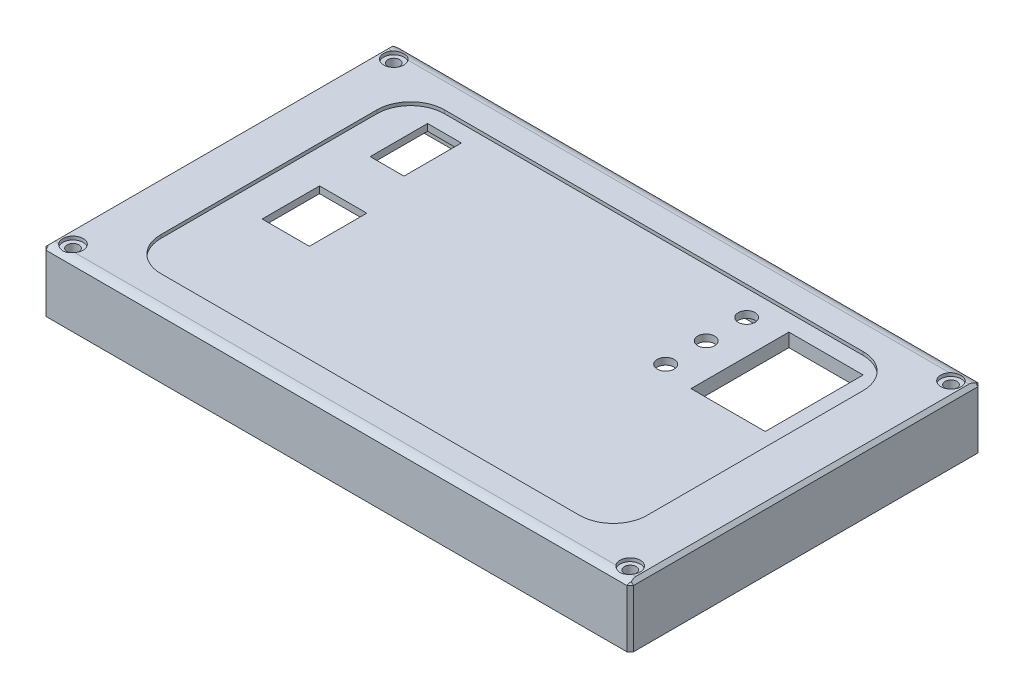
from build123d import *

# Parameters (mm, degrees)
SKETCH1_W           = 174
SKETCH1_H           = 104
BOSS_EXTRUDE3_DEPTH = 18
SKETCH5_W           = 172
SKETCH5_H           = 102
CUT_EXTRUDE2_DEPTH  = 10
SKETCH6_W           = 170
SKETCH6_H           = 100
CUT_EXTRUDE4_DEPTH  = 5
BOSS_EXTRUDE4_DEPTH = 5
SKETCH10_R          = 1.75
CUT_EXTRUDE5_DEPTH  = 8
SKETCH11_R          = 3
CUT_EXTRUDE6_DEPTH  = 1
SKETCH12_W          = 144
SKETCH12_H          = 84
CUT_EXTRUDE7_DEPTH  = 1
FILLET1_R           = 10
CHAMFER1_SIZE       = 1
SKETCH13_W          = 22
SKETCH13_H          = 29
CUT_EXTRUDE8_DEPTH  = 2
SKETCH14_R          = 2.5
CUT_EXTRUDE9_DEPTH  = 2
SKETCH15_R          = 3
BOSS_EXTRUDE5_DEPTH = 5
SKETCH16_R          = 1.75
CUT_EXTRUDE10_DEPTH = 3
THREAD1_PITCH       = 1.27
THREAD2_PITCH       = 1.27
THREAD3_PITCH       = 1.27
THREAD4_PITCH       = 1.27
SKETCH25_W          = 14
SKETCH25_H          = 17
SKETCH25_W_2        = 10
CUT_EXTRUDE11_DEPTH = 2
SKETCH26_W          = 25
SKETCH26_H          = 32
SKETCH26_W_2        = 22
SKETCH26_H_2        = 29
BOSS_EXTRUDE6_DEPTH = 2
FILLET3_R           = 4


with BuildPart() as part:
    # Sketch1 → Boss-Extrude3 (new body)
    with BuildSketch(Plane(origin=(0, 0, 0), x_dir=(1, 0, 0), z_dir=(0, 1, 0))):
        with Locations((87, 52)):
            Rectangle(SKETCH1_W, SKETCH1_H)
    extrude(amount=-BOSS_EXTRUDE3_DEPTH)

    # Sketch5 → Cut-Extrude2 (cut)
    with BuildSketch(Plane(origin=(0, -18, 0), x_dir=(-1, 0, 0), z_dir=(0, -1, 0))):
        with Locations((-87, 52)):
            Rectangle(SKETCH5_W, SKETCH5_H)
    extrude(amount=-CUT_EXTRUDE2_DEPTH, mode=Mode.SUBTRACT)

    # Sketch6 → Cut-Extrude4 (cut)
    with BuildSketch(Plane.XZ.offset(8)):
        with Locations((87, -52)):
            Rectangle(SKETCH6_W, SKETCH6_H)
    extrude(amount=-CUT_EXTRUDE4_DEPTH, mode=Mode.SUBTRACT)

    # Sketch7 → Boss-Extrude4 (add)
    with BuildSketch(Plane(origin=(0, -3, 0), x_dir=(-1, 0, 0), z_dir=(0, -1, 0))):
        with BuildLine():
            Line((-165.169872981, 102), (-172, 102))
            Line((-172, 102), (-172, 95.169872981))
            ThreePointArc((-172, 95.169872981), (-165.964466094, 95.964466094), (-165.169872981, 102))
        make_face()
        with BuildLine():
            Line((-2, 95.169872981), (-2, 102))
            Line((-2, 102), (-8.830127019, 102))
            ThreePointArc((-8.830127019, 102), (-8.035533906, 95.964466094), (-2, 95.169872981))
        make_face()
        with BuildLine():
            Line((-8.830127019, 2), (-2, 2))
            Line((-2, 2), (-2, 8.830127019))
            ThreePointArc((-2, 8.830127019), (-8.035533906, 8.035533906), (-8.830127019, 2))
        make_face()
        with BuildLine():
            Line((-172, 8.830127019), (-172, 2))
            Line((-172, 2), (-165.169872981, 2))
            ThreePointArc((-165.169872981, 2), (-165.964466094, 8.035533906), (-172, 8.830127019))
        make_face()
    extrude(amount=BOSS_EXTRUDE4_DEPTH)

    # Sketch10 → Cut-Extrude5 (cut)
    with BuildSketch(Plane(origin=(0, -8, 0), x_dir=(-1, 0, 0), z_dir=(0, -1, 0))):
        with Locations(Location((-169.5, 4.5, 0), (0, 0, 90))):
            Circle(SKETCH10_R)
        with Locations(Location((-4.5, 4.5, 0), (0, 0, 90))):
            Circle(SKETCH10_R)
        with Locations(Location((-4.5, 99.5, 0), (0, 0, 90))):
            Circle(SKETCH10_R)
        with Locations(Location((-169.5, 99.5, 0), (0, 0, 90))):
            Circle(SKETCH10_R)
    extrude(amount=-CUT_EXTRUDE5_DEPTH, mode=Mode.SUBTRACT)

    # Sketch11 → Cut-Extrude6 (cut)
    with BuildSketch(Plane(origin=(0, 0, 0), x_dir=(1, 0, 0), z_dir=(0, 1, 0))):
        with Locations(Location((4.5, 99.5, 0), (0, 0, 270))):
            Circle(SKETCH11_R)
        with Locations(Location((169.5, 99.5, 0), (0, 0, 270))):
            Circle(SKETCH11_R)
        with Locations(Location((169.5, 4.5, 0), (0, 0, 270))):
            Circle(SKETCH11_R)
        with Locations(Location((4.5, 4.5, 0), (0, 0, 270))):
            Circle(SKETCH11_R)
    extrude(amount=-CUT_EXTRUDE6_DEPTH, mode=Mode.SUBTRACT)

    # Sketch12 → Cut-Extrude7 (cut)
    with BuildSketch(Plane(origin=(0, 0, 0), x_dir=(1, 0, 0), z_dir=(0, 1, 0))):
        with Locations((87, 52)):
            Rectangle(SKETCH12_W, SKETCH12_H)
    extrude(amount=-CUT_EXTRUDE7_DEPTH, mode=Mode.SUBTRACT)

    # Fillet1
    fillet1_edges = [part.edges().sort_by_distance(p)[0] for p in [
        (15, -0.5, -10),
        (15, -0.5, -94),
        (159, -0.5, -94),
        (159, -0.5, -10),
    ]]
    fillet(fillet1_edges, radius=FILLET1_R)

    # Chamfer1
    chamfer1_edges = [part.edges().sort_by_distance(p)[0] for p in [
        (87, 0, -104),
        (174, 0, -52),
        (87, 0, 0),
        (0, 0, -52),
        (0, -9, -104),
        (174, -9, -104),
        (174, -9, 0),
        (0, -9, 0),
    ]]
    chamfer(chamfer1_edges, length=CHAMFER1_SIZE)

    # Sketch13 → Cut-Extrude8 (cut)
    with BuildSketch(Plane(origin=(0, -1, 0), x_dir=(1, 0, 0), z_dir=(0, 1, 0))):
        with Locations((143, 74.5)):
            Rectangle(SKETCH13_W, SKETCH13_H)
    extrude(amount=-CUT_EXTRUDE8_DEPTH, mode=Mode.SUBTRACT)

    # Sketch14 → Cut-Extrude9 (cut)
    with BuildSketch(Plane(origin=(0, -1, 0), x_dir=(1, 0, 0), z_dir=(0, 1, 0))):
        with Locations(Location((122, 86.5, 0), (0, 0, 270))):
            Circle(SKETCH14_R)
        with Locations(Location((122, 74.5, 0), (0, 0, 270))):
            Circle(SKETCH14_R)
        with Locations(Location((122, 62.5, 0), (0, 0, 270))):
            Circle(SKETCH14_R)
    extrude(amount=-CUT_EXTRUDE9_DEPTH, mode=Mode.SUBTRACT)

    # Sketch15 → Boss-Extrude5 (add)
    with BuildSketch(Plane(origin=(0, -1, 0), x_dir=(1, 0, 0), z_dir=(0, 1, 0))):
        with Locations(Location((162, 92, 0), (0, 0, 270))):
            Circle(SKETCH15_R)
        with Locations(Location((98, 92, 0), (0, 0, 270))):
            Circle(SKETCH15_R)
        with Locations(Location((162, 48, 0), (0, 0, 270))):
            Circle(SKETCH15_R)
        with Locations(Location((98, 48, 0), (0, 0, 270))):
            Circle(SKETCH15_R)
    extrude(amount=-BOSS_EXTRUDE5_DEPTH)

    # Sketch16 → Cut-Extrude10 (cut)
    with BuildSketch(Plane(origin=(0, -6, 0), x_dir=(-1, 0, 0), z_dir=(0, -1, 0))):
        with Locations(Location((-162, 92, 0), (0, 0, 90))):
            Circle(SKETCH16_R)
        with Locations(Location((-98, 92, 0), (0, 0, 90))):
            Circle(SKETCH16_R)
        with Locations(Location((-162, 48, 0), (0, 0, 90))):
            Circle(SKETCH16_R)
        with Locations(Location((-98, 48, 0), (0, 0, 90))):
            Circle(SKETCH16_R)
    extrude(amount=-CUT_EXTRUDE10_DEPTH, mode=Mode.SUBTRACT)

    # Thread1: the profile of Thread Profile1 profile screwed along a right-hand helix of 2.362205 turns, 8 arcs to a turn; built about Z, then put on its axis
    thread1_z = Axis((0, 0, 0), (0, 0, 1))
    thread1_corners = [(1.7503, 0, -0.000173205), (1.7503, 0, 1.111423202), (1.062592339, 0, 0.714374998), (1.062592339, 0, 0.396874998)]
    with BuildLine(mode=Mode.PRIVATE) as thread1_profile:
        Line(thread1_corners[0], thread1_corners[1])
        Line(thread1_corners[1], thread1_corners[2])
        Line(thread1_corners[2], thread1_corners[3])
        Line(thread1_corners[3], thread1_corners[0])
    thread1_cap = Face(thread1_profile.wire())
    thread1_turn_angles = [0, 22.5, 45, 67.5, 90, 112.5, 135, 157.5, 180, 202.5, 225, 247.5, 270, 292.5, 315, 337.5, 360]
    thread1_turn_weights = [1, 0.9238795325112867, 1, 0.9238795325112867, 1, 0.9238795325112867, 1, 0.9238795325112867, 1, 0.9238795325112867, 1, 0.9238795325112867, 1, 0.9238795325112867, 1, 0.9238795325112867, 1]
    thread1_turn_rails = [Edge.make_bspline([Vector(p[0], p[1], 0).rotate(thread1_z, thread1_turn_angles[k]) / thread1_turn_weights[k] + Vector(0, 0, p[2] + THREAD1_PITCH * thread1_turn_angles[k] / 360) for k in range(17)], [0, 0, 0, 1, 1, 2, 2, 3, 3, 4, 4, 5, 5, 6, 6, 7, 7, 8, 8, 8], 2, thread1_turn_weights) for p in thread1_corners]
    thread1_turn_sides = [Face.make_surface_from_curves(thread1_turn_rails[p[0]], thread1_turn_rails[p[1]]) for p in [(0, 1), (1, 2), (2, 3), (3, 0)]]
    thread1_last_angles = [720, 742.5, 765, 787.5, 810, 830.196850394, 850.393700787]
    thread1_last_weights = [1, 0.9238795325112867, 1, 0.9238795325112867, 1, 0.9385120027288909, 1]
    thread1_last_rails = [Edge.make_bspline([Vector(p[0], p[1], 0).rotate(thread1_z, thread1_last_angles[k]) / thread1_last_weights[k] + Vector(0, 0, p[2] + THREAD1_PITCH * thread1_last_angles[k] / 360) for k in range(7)], [0, 0, 0, 1, 1, 2, 2, 3, 3, 3], 2, thread1_last_weights) for p in thread1_corners]
    thread1_last_sides = [Face.make_surface_from_curves(thread1_last_rails[p[0]], thread1_last_rails[p[1]]) for p in [(0, 1), (1, 2), (2, 3), (3, 0)]]
    thread1 = Plane(origin=(162, -6, -92), x_dir=(1, 0, 0), z_dir=(0, 1, 0)) * Solid(Shell([*[p.moved(Location((0, 0, THREAD1_PITCH * i))) for i in range(2) for p in thread1_turn_sides], *thread1_last_sides, thread1_cap, thread1_cap.rotate(thread1_z, 850.393700787).moved(Location((0, 0, THREAD1_PITCH * 850.393700787 / 360)))]))
    add(thread1)

    # Thread2: the profile of Thread Profile2 profile screwed along a right-hand helix of 2.362205 turns, 8 arcs to a turn; built about Z, then put on its axis
    thread2_z = Axis((0, 0, 0), (0, 0, 1))
    thread2_corners = [(1.7503, 0, -0.000173205), (1.7503, 0, 1.111423202), (1.062592339, 0, 0.714374998), (1.062592339, 0, 0.396874998)]
    with BuildLine(mode=Mode.PRIVATE) as thread2_profile:
        Line(thread2_corners[0], thread2_corners[1])
        Line(thread2_corners[1], thread2_corners[2])
        Line(thread2_corners[2], thread2_corners[3])
        Line(thread2_corners[3], thread2_corners[0])
    thread2_cap = Face(thread2_profile.wire())
    thread2_turn_angles = [0, 22.5, 45, 67.5, 90, 112.5, 135, 157.5, 180, 202.5, 225, 247.5, 270, 292.5, 315, 337.5, 360]
    thread2_turn_weights = [1, 0.9238795325112867, 1, 0.9238795325112867, 1, 0.9238795325112867, 1, 0.9238795325112867, 1, 0.9238795325112867, 1, 0.9238795325112867, 1, 0.9238795325112867, 1, 0.9238795325112867, 1]
    thread2_turn_rails = [Edge.make_bspline([Vector(p[0], p[1], 0).rotate(thread2_z, thread2_turn_angles[k]) / thread2_turn_weights[k] + Vector(0, 0, p[2] + THREAD2_PITCH * thread2_turn_angles[k] / 360) for k in range(17)], [0, 0, 0, 1, 1, 2, 2, 3, 3, 4, 4, 5, 5, 6, 6, 7, 7, 8, 8, 8], 2, thread2_turn_weights) for p in thread2_corners]
    thread2_turn_sides = [Face.make_surface_from_curves(thread2_turn_rails[p[0]], thread2_turn_rails[p[1]]) for p in [(0, 1), (1, 2), (2, 3), (3, 0)]]
    thread2_last_angles = [720, 742.5, 765, 787.5, 810, 830.196850394, 850.393700787]
    thread2_last_weights = [1, 0.9238795325112867, 1, 0.9238795325112867, 1, 0.9385120027288909, 1]
    thread2_last_rails = [Edge.make_bspline([Vector(p[0], p[1], 0).rotate(thread2_z, thread2_last_angles[k]) / thread2_last_weights[k] + Vector(0, 0, p[2] + THREAD2_PITCH * thread2_last_angles[k] / 360) for k in range(7)], [0, 0, 0, 1, 1, 2, 2, 3, 3, 3], 2, thread2_last_weights) for p in thread2_corners]
    thread2_last_sides = [Face.make_surface_from_curves(thread2_last_rails[p[0]], thread2_last_rails[p[1]]) for p in [(0, 1), (1, 2), (2, 3), (3, 0)]]
    thread2 = Plane(origin=(98, -6, -92), x_dir=(1, 0, 0), z_dir=(0, 1, 0)) * Solid(Shell([*[p.moved(Location((0, 0, THREAD2_PITCH * i))) for i in range(2) for p in thread2_turn_sides], *thread2_last_sides, thread2_cap, thread2_cap.rotate(thread2_z, 850.393700787).moved(Location((0, 0, THREAD2_PITCH * 850.393700787 / 360)))]))
    add(thread2)

    # Thread3: the profile of Thread Profile3 profile screwed along a right-hand helix of 2.362205 turns, 8 arcs to a turn; built about Z, then put on its axis
    thread3_z = Axis((0, 0, 0), (0, 0, 1))
    thread3_corners = [(1.7503, 0, -0.000173205), (1.7503, 0, 1.111423202), (1.062592339, 0, 0.714374998), (1.062592339, 0, 0.396874998)]
    with BuildLine(mode=Mode.PRIVATE) as thread3_profile:
        Line(thread3_corners[0], thread3_corners[1])
        Line(thread3_corners[1], thread3_corners[2])
        Line(thread3_corners[2], thread3_corners[3])
        Line(thread3_corners[3], thread3_corners[0])
    thread3_cap = Face(thread3_profile.wire())
    thread3_turn_angles = [0, 22.5, 45, 67.5, 90, 112.5, 135, 157.5, 180, 202.5, 225, 247.5, 270, 292.5, 315, 337.5, 360]
    thread3_turn_weights = [1, 0.9238795325112867, 1, 0.9238795325112867, 1, 0.9238795325112867, 1, 0.9238795325112867, 1, 0.9238795325112867, 1, 0.9238795325112867, 1, 0.9238795325112867, 1, 0.9238795325112867, 1]
    thread3_turn_rails = [Edge.make_bspline([Vector(p[0], p[1], 0).rotate(thread3_z, thread3_turn_angles[k]) / thread3_turn_weights[k] + Vector(0, 0, p[2] + THREAD3_PITCH * thread3_turn_angles[k] / 360) for k in range(17)], [0, 0, 0, 1, 1, 2, 2, 3, 3, 4, 4, 5, 5, 6, 6, 7, 7, 8, 8, 8], 2, thread3_turn_weights) for p in thread3_corners]
    thread3_turn_sides = [Face.make_surface_from_curves(thread3_turn_rails[p[0]], thread3_turn_rails[p[1]]) for p in [(0, 1), (1, 2), (2, 3), (3, 0)]]
    thread3_last_angles = [720, 742.5, 765, 787.5, 810, 830.196850394, 850.393700787]
    thread3_last_weights = [1, 0.9238795325112867, 1, 0.9238795325112867, 1, 0.9385120027288909, 1]
    thread3_last_rails = [Edge.make_bspline([Vector(p[0], p[1], 0).rotate(thread3_z, thread3_last_angles[k]) / thread3_last_weights[k] + Vector(0, 0, p[2] + THREAD3_PITCH * thread3_last_angles[k] / 360) for k in range(7)], [0, 0, 0, 1, 1, 2, 2, 3, 3, 3], 2, thread3_last_weights) for p in thread3_corners]
    thread3_last_sides = [Face.make_surface_from_curves(thread3_last_rails[p[0]], thread3_last_rails[p[1]]) for p in [(0, 1), (1, 2), (2, 3), (3, 0)]]
    thread3 = Plane(origin=(98, -6, -48), x_dir=(1, 0, 0), z_dir=(0, 1, 0)) * Solid(Shell([*[p.moved(Location((0, 0, THREAD3_PITCH * i))) for i in range(2) for p in thread3_turn_sides], *thread3_last_sides, thread3_cap, thread3_cap.rotate(thread3_z, 850.393700787).moved(Location((0, 0, THREAD3_PITCH * 850.393700787 / 360)))]))
    add(thread3)

    # Thread4: the profile of Thread Profile4 profile screwed along a right-hand helix of 2.362205 turns, 8 arcs to a turn; built about Z, then put on its axis
    thread4_z = Axis((0, 0, 0), (0, 0, 1))
    thread4_corners = [(1.7503, 0, -0.000173205), (1.7503, 0, 1.111423202), (1.062592339, 0, 0.714374998), (1.062592339, 0, 0.396874998)]
    with BuildLine(mode=Mode.PRIVATE) as thread4_profile:
        Line(thread4_corners[0], thread4_corners[1])
        Line(thread4_corners[1], thread4_corners[2])
        Line(thread4_corners[2], thread4_corners[3])
        Line(thread4_corners[3], thread4_corners[0])
    thread4_cap = Face(thread4_profile.wire())
    thread4_turn_angles = [0, 22.5, 45, 67.5, 90, 112.5, 135, 157.5, 180, 202.5, 225, 247.5, 270, 292.5, 315, 337.5, 360]
    thread4_turn_weights = [1, 0.9238795325112867, 1, 0.9238795325112867, 1, 0.9238795325112867, 1, 0.9238795325112867, 1, 0.9238795325112867, 1, 0.9238795325112867, 1, 0.9238795325112867, 1, 0.9238795325112867, 1]
    thread4_turn_rails = [Edge.make_bspline([Vector(p[0], p[1], 0).rotate(thread4_z, thread4_turn_angles[k]) / thread4_turn_weights[k] + Vector(0, 0, p[2] + THREAD4_PITCH * thread4_turn_angles[k] / 360) for k in range(17)], [0, 0, 0, 1, 1, 2, 2, 3, 3, 4, 4, 5, 5, 6, 6, 7, 7, 8, 8, 8], 2, thread4_turn_weights) for p in thread4_corners]
    thread4_turn_sides = [Face.make_surface_from_curves(thread4_turn_rails[p[0]], thread4_turn_rails[p[1]]) for p in [(0, 1), (1, 2), (2, 3), (3, 0)]]
    thread4_last_angles = [720, 742.5, 765, 787.5, 810, 830.196850394, 850.393700787]
    thread4_last_weights = [1, 0.9238795325112867, 1, 0.9238795325112867, 1, 0.9385120027288909, 1]
    thread4_last_rails = [Edge.make_bspline([Vector(p[0], p[1], 0).rotate(thread4_z, thread4_last_angles[k]) / thread4_last_weights[k] + Vector(0, 0, p[2] + THREAD4_PITCH * thread4_last_angles[k] / 360) for k in range(7)], [0, 0, 0, 1, 1, 2, 2, 3, 3, 3], 2, thread4_last_weights) for p in thread4_corners]
    thread4_last_sides = [Face.make_surface_from_curves(thread4_last_rails[p[0]], thread4_last_rails[p[1]]) for p in [(0, 1), (1, 2), (2, 3), (3, 0)]]
    thread4 = Plane(origin=(162, -6, -48), x_dir=(1, 0, 0), z_dir=(0, 1, 0)) * Solid(Shell([*[p.moved(Location((0, 0, THREAD4_PITCH * i))) for i in range(2) for p in thread4_turn_sides], *thread4_last_sides, thread4_cap, thread4_cap.rotate(thread4_z, 850.393700787).moved(Location((0, 0, THREAD4_PITCH * 850.393700787 / 360)))]))
    add(thread4)

    # Sketch25 → Cut-Extrude11 (cut)
    with BuildSketch(Plane(origin=(0, -1, 0), x_dir=(1, 0, 0), z_dir=(0, 1, 0))):
        with Locations((32, 48.5)):
            Rectangle(SKETCH25_W, SKETCH25_H)
        with Locations((30, 80.5)):
            Rectangle(SKETCH25_W_2, SKETCH25_H)
    extrude(amount=-CUT_EXTRUDE11_DEPTH, mode=Mode.SUBTRACT)

    # Sketch26 → Boss-Extrude6 (add)
    with BuildSketch(Plane(origin=(0, -3, 0), x_dir=(-1, 0, 0), z_dir=(0, -1, 0))):
        with Locations((-143, 74.5)):
            Rectangle(SKETCH26_W, SKETCH26_H)
        with Locations((-143, 74.5)):
            Rectangle(SKETCH26_W_2, SKETCH26_H_2, mode=Mode.SUBTRACT)
    extrude(amount=BOSS_EXTRUDE6_DEPTH)

    # Fillet3
    # the kernel refuses this fillet: 4 mm, written as the material it takes off along each edge
    with BuildSketch(Plane(origin=(-3.114378278, 0, -1), x_dir=(0, 0, -1), z_dir=(1, 0, 0)), Plane(origin=(177.114378278, 0, -103), x_dir=(0, 0, 1), z_dir=(-1, 0, 0))) as fillet3_piece_1:
        with BuildLine():
            CenterArc((1.645751311, -4), FILLET3_R, 90, 41.409622109)
            Line((-1, -1), (-1.052915026, -0.94))
            ThreePointArc((-1.052915026, -0.94), (-0.556568542, -0.443431458), (-0.056568542, 0.056568542))
            Line((-0.056568542, 0.056568542), (0, 0.08))
            Line((0, 0.08), (1.645751311, 0.08))
            Line((1.645751311, 0.08), (1.645751311, 0))
        make_face()
    extrude(amount=180.228756555, mode=Mode.SUBTRACT)


solid = part.part
